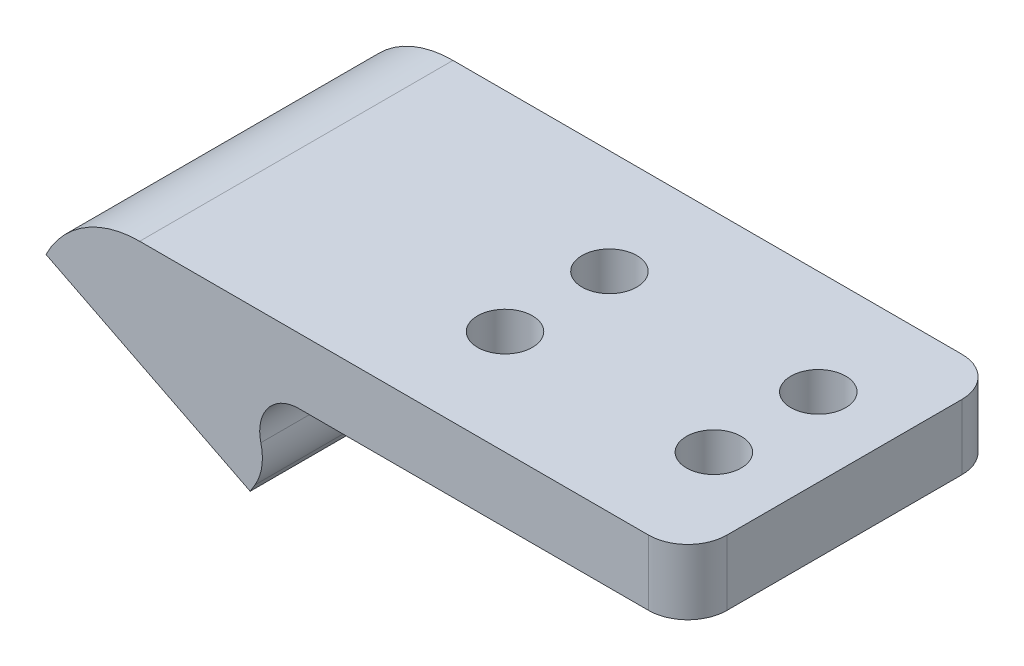
from build123d import *

# Parameters (mm, degrees)
ESQUISSE1_W             = 17
ESQUISSE1_H             = 5
BOSS_EXTRU_1_DEPTH      = 24
BOSS_EXTRU_2_DEPTH      = 24
CONG_1_R                = 4
CONG_2_R                = 8
CONG_3_R                = 3
ESQUISSE3_W             = 24
ESQUISSE3_H             = 5
BOSS_EXTRU_3_DEPTH      = 20
ESQUISSE4_R             = 2.1
ENL_V_MAT_EXTRU_1_DEPTH = 10
CONG_4_R                = 3
ESQUISSE5_R             = 2.25
ENL_V_MAT_EXTRU_2_DEPTH = 3


with BuildPart() as part:
    # Esquisse1 → Boss.-Extru.1 (new body)
    with BuildSketch(Plane.XY):
        with Locations((1.940369129, 2.5)):
            Rectangle(ESQUISSE1_W, ESQUISSE1_H)
    extrude(amount=BOSS_EXTRU_1_DEPTH)

    # Esquisse2 → Boss.-Extru.2 (add)
    with BuildSketch(Plane.XY.offset(24)):
        Polygon((-6.559630871, 0), (-6.559630871, 5), (-16.471058056, 5), (-18.723069156, 0.535871193), (-3.080508445, -7.355303518), (-0.501566554, -3.056100904), align=None)
    extrude(amount=-BOSS_EXTRU_2_DEPTH)

    # Congé1
    cong_1_edges = [part.edges().sort_by_distance(p)[0] for p in [
        (-0.501566554, -3.056100904, 12),
    ]]
    fillet(cong_1_edges, radius=CONG_1_R)

    # Congé2
    cong_2_edges = [part.edges().sort_by_distance(p)[0] for p in [
        (-16.471058056, 5, 12),
    ]]
    fillet(cong_2_edges, radius=CONG_2_R)

    # Congé3
    cong_3_edges = [part.edges().sort_by_distance(p)[0] for p in [
        (-6.559630871, 0, 12),
    ]]
    fillet(cong_3_edges, radius=CONG_3_R)

    # Esquisse3 → Boss.-Extru.3 (add)
    with BuildSketch(Plane(origin=(10.440369129, 0, 0), x_dir=(0, 0, -1), z_dir=(1, 0, 0))):
        with Locations((-12, 2.5)):
            Rectangle(ESQUISSE3_W, ESQUISSE3_H)
    extrude(amount=BOSS_EXTRU_3_DEPTH)

    # Esquisse4 → Enlèv. mat.-Extru.1 (cut)
    with BuildSketch(Plane(origin=(0, 5, 0), x_dir=(1, 0, 0), z_dir=(0, 1, 0))):
        with Locations((8.440369129, -8)):
            Circle(ESQUISSE4_R)
        with Locations((24.440369129, -8)):
            Circle(ESQUISSE4_R)
        with Locations((8.440369129, -16)):
            Circle(ESQUISSE4_R)
        with Locations((24.440369129, -16)):
            Circle(ESQUISSE4_R)
    extrude(amount=-ENL_V_MAT_EXTRU_1_DEPTH, mode=Mode.SUBTRACT)

    # Congé4
    cong_4_edges = [part.edges().sort_by_distance(p)[0] for p in [
        (30.440369129, 2.5, 0),
        (30.440369129, 2.5, 24),
    ]]
    fillet(cong_4_edges, radius=CONG_4_R)

    # Esquisse5 → Enlèv. mat.-Extru.2 (cut)
    with BuildSketch(Plane(origin=(-3.582711985, -7.101957793, 0), x_dir=(0.892825761431464, -0.45040221993716517, 0), z_dir=(-0.45040221993716517, -0.892825761431464, 0))):
        with Locations((-12.147654158, 8.05)):
            Circle(ESQUISSE5_R)
        with Locations((-12.147654158, 15.95)):
            Circle(ESQUISSE5_R)
        with Locations((-4.247654158, 15.95)):
            Circle(ESQUISSE5_R)
        with Locations((-4.247654158, 8.05)):
            Circle(ESQUISSE5_R)
    extrude(amount=-ENL_V_MAT_EXTRU_2_DEPTH, mode=Mode.SUBTRACT)


solid = part.part
